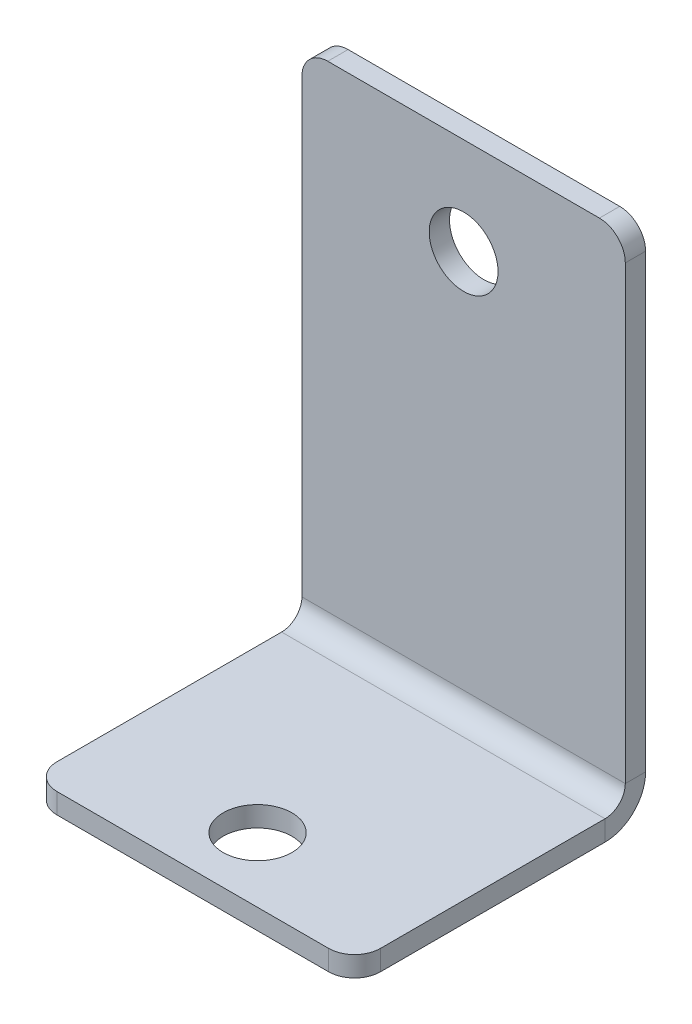
from build123d import *

# Parameters (mm, degrees)
BASE_FLANGE1_DEPTH      = 31.75
F_1_4_CLEARANCE_HOLE1_D = 6.7564
F_1_4_CLEARANCE_HOLE2_D = 6.7564
FILLET1_R               = 2.54


# Sheet-metal steps are written as plain solids
with BuildPart() as part:
    # Sketch1 → Base-Flange1 (new body)
    with BuildSketch(Plane(origin=(0, 0, 0), x_dir=(0, 0, -1), z_dir=(1, 0, 0))):
        with BuildLine():
            Line((-28.575, 0), (-3.9878, 0))
            ThreePointArc((-3.9878, 0), (-1.167999578, 1.167999578), (0, 3.9878))
            Line((0, 3.9878), (0, 50.8))
            Line((0, 50.8), (-1.9939, 50.8))
            Line((-1.9939, 50.8), (-1.9939, 3.9878))
            ThreePointArc((-1.9939, 3.9878), (-2.577899789, 2.577899789), (-3.9878, 1.9939))
            Line((-3.9878, 1.9939), (-28.575, 1.9939))
            Line((-28.575, 1.9939), (-28.575, 0))
        make_face()
    extrude(amount=BASE_FLANGE1_DEPTH)

    # 1/4 Clearance Hole1 (through all)
    with Locations(Plane.XY.offset(1.9939)):
        with Locations((15.875, 41.275)):
            Hole(F_1_4_CLEARANCE_HOLE1_D / 2)

    # 1/4 Clearance Hole2 (through all)
    with Locations(Plane(origin=(0, 1.9939, 0), x_dir=(1, 0, 0), z_dir=(0, 1, 0))):
        with Locations((15.875, -22.225)):
            Hole(F_1_4_CLEARANCE_HOLE2_D / 2)

    # Fillet1
    fillet1_edges = [part.edges().sort_by_distance(p)[0] for p in [
        (31.75, 0.99695, 28.575),
        (0, 0.99695, 28.575),
        (31.75, 50.8, 0.99695),
        (0, 50.8, 0.99695),
    ]]
    fillet(fillet1_edges, radius=FILLET1_R)


solid = part.part
